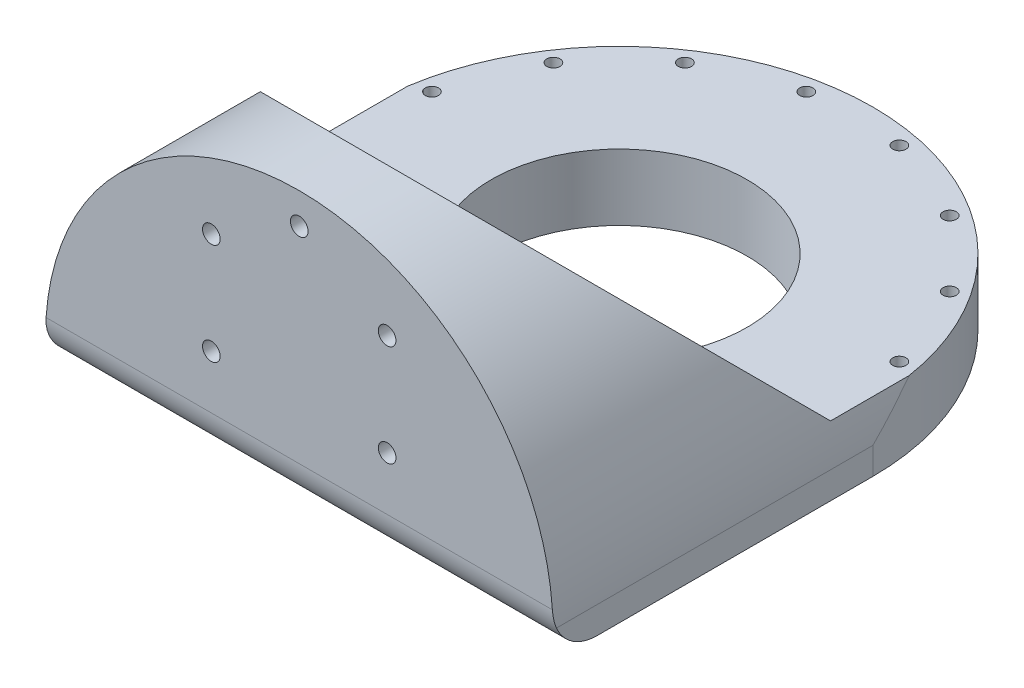
from build123d import *

# Parameters (mm, degrees)
SKETCH1_R           = 1.5
SKETCH1_R_2         = 29
BOSS_EXTRUDE1_DEPTH = 15
BOSS_EXTRUDE2_DEPTH = 115
CUT_EXTRUDE1_START  = -48.6
SKETCH3_R           = 57.5
CUT_EXTRUDE1_DEPTH  = 48.6
SKETCH5_R           = 2
CUT_EXTRUDE3_DEPTH  = 75.6
SKETCH6_R           = 4.25
CUT_EXTRUDE4_DEPTH  = 62.5
CUT_EXTRUDE2_DEPTH  = 132.6
FILLET1_R           = 10


with BuildPart() as part:
    # Sketch1 → Boss-Extrude1 (new body)
    with BuildSketch(Plane(origin=(0, 0, 0), x_dir=(1, 0, 0), z_dir=(0, 1, 0))):
        with BuildLine():
            Line((-57.5, -57.5), (57.5, -57.5))
            Line((57.5, -57.5), (57.5, 0))
            ThreePointArc((57.5, 0), (0, 57.5), (-57.5, 0))
            Line((-57.5, 0), (-57.5, -57.5))
        make_face()
        with Locations((30.000792583, 44.899359064)):
            Circle(SKETCH1_R, mode=Mode.SUBTRACT)
        with Locations((-30.000792583, -44.899359064)):
            Circle(SKETCH1_R, mode=Mode.SUBTRACT)
        with Locations((-44.899359064, -30.000792583)):
            Circle(SKETCH1_R, mode=Mode.SUBTRACT)
        with Locations((-10.534877389, -52.962405142)):
            Circle(SKETCH1_R, mode=Mode.SUBTRACT)
        with Locations((-52.962405142, -10.534877389)):
            Circle(SKETCH1_R, mode=Mode.SUBTRACT)
        Circle(SKETCH1_R_2, mode=Mode.SUBTRACT)
        with Locations((10.534877389, -52.962405142)):
            Circle(SKETCH1_R, mode=Mode.SUBTRACT)
        with Locations((30.000792583, -44.899359064)):
            Circle(SKETCH1_R, mode=Mode.SUBTRACT)
        with Locations((44.899359064, -30.000792583)):
            Circle(SKETCH1_R, mode=Mode.SUBTRACT)
        with Locations((52.962405142, -10.534877389)):
            Circle(SKETCH1_R, mode=Mode.SUBTRACT)
        with Locations((-52.962405142, 10.534877389)):
            Circle(SKETCH1_R, mode=Mode.SUBTRACT)
        with Locations((-44.899359064, 30.000792583)):
            Circle(SKETCH1_R, mode=Mode.SUBTRACT)
        with Locations((-30.000792583, 44.899359064)):
            Circle(SKETCH1_R, mode=Mode.SUBTRACT)
        with Locations((-10.534877389, 52.962405142)):
            Circle(SKETCH1_R, mode=Mode.SUBTRACT)
        with Locations((52.962405142, 10.534877389)):
            Circle(SKETCH1_R, mode=Mode.SUBTRACT)
        with Locations((10.534877389, 52.962405142)):
            Circle(SKETCH1_R, mode=Mode.SUBTRACT)
        with Locations((44.899359064, 30.000792583)):
            Circle(SKETCH1_R, mode=Mode.SUBTRACT)
    extrude(amount=BOSS_EXTRUDE1_DEPTH)

    # Sketch2 → Boss-Extrude2 (add)
    with BuildSketch(Plane.ZY.offset(57.5)):
        Polygon((57.5, 15), (57.5, 0), (72.5, 0), (72.5, 63.6), (57.5, 63.6), (0, 15), align=None)
    extrude(amount=-BOSS_EXTRUDE2_DEPTH)

    # Sketch3 → Cut-Extrude1 (cut)
    with BuildSketch(Plane(origin=(0, 63.6, 0), x_dir=(1, 0, 0), z_dir=(0, 1, 0)).offset(CUT_EXTRUDE1_START)):
        Circle(SKETCH3_R)
    extrude(amount=CUT_EXTRUDE1_DEPTH, mode=Mode.SUBTRACT)

    # Sketch5 → Cut-Extrude3 (cut)
    with BuildSketch(Plane.XY.offset(72.5)):
        with Locations((0, 56.6)):
            Circle(SKETCH5_R)
        with Locations((-19.918584287, 45.1)):
            Circle(SKETCH5_R)
        with Locations((-19.918584287, 22.1)):
            Circle(SKETCH5_R)
        with Locations((19.918584287, 22.1)):
            Circle(SKETCH5_R)
        with Locations((19.918584287, 45.1)):
            Circle(SKETCH5_R)
    extrude(amount=-CUT_EXTRUDE3_DEPTH, mode=Mode.SUBTRACT)

    # Sketch6 → Cut-Extrude4 (cut)
    with BuildSketch(Plane.XY):
        with Locations((0, 56.6)):
            Circle(SKETCH6_R)
        with Locations((19.918584287, 45.1)):
            Circle(SKETCH6_R)
        with Locations((19.918584287, 22.1)):
            Circle(SKETCH6_R)
        with Locations((-19.918584287, 22.1)):
            Circle(SKETCH6_R)
        with Locations((-19.918584287, 45.1)):
            Circle(SKETCH6_R)
    extrude(amount=CUT_EXTRUDE4_DEPTH, mode=Mode.SUBTRACT)

    # Sketch4 → Cut-Extrude2 (cut)
    with BuildSketch(Plane.XY.offset(72.5)):
        with BuildLine():
            Line((-57.5, 63.6), (-57.5, 6.099999962))
            ThreePointArc((-57.5, 6.099999962), (-40.658639932, 46.758639905), (0, 63.6))
            Line((0, 63.6), (-57.5, 63.6))
        make_face()
        with BuildLine():
            Line((57.5, 63.6), (0, 63.6))
            ThreePointArc((0, 63.6), (40.658639918, 46.758639918), (57.5, 6.1))
            Line((57.5, 6.1), (57.5, 63.6))
        make_face()
    extrude(amount=-CUT_EXTRUDE2_DEPTH, mode=Mode.SUBTRACT)

    # Fillet1
    fillet1_edges = [part.edges().sort_by_distance(p)[0] for p in [
        (0, 0, 72.5),
    ]]
    fillet(fillet1_edges, radius=FILLET1_R)


solid = part.part
